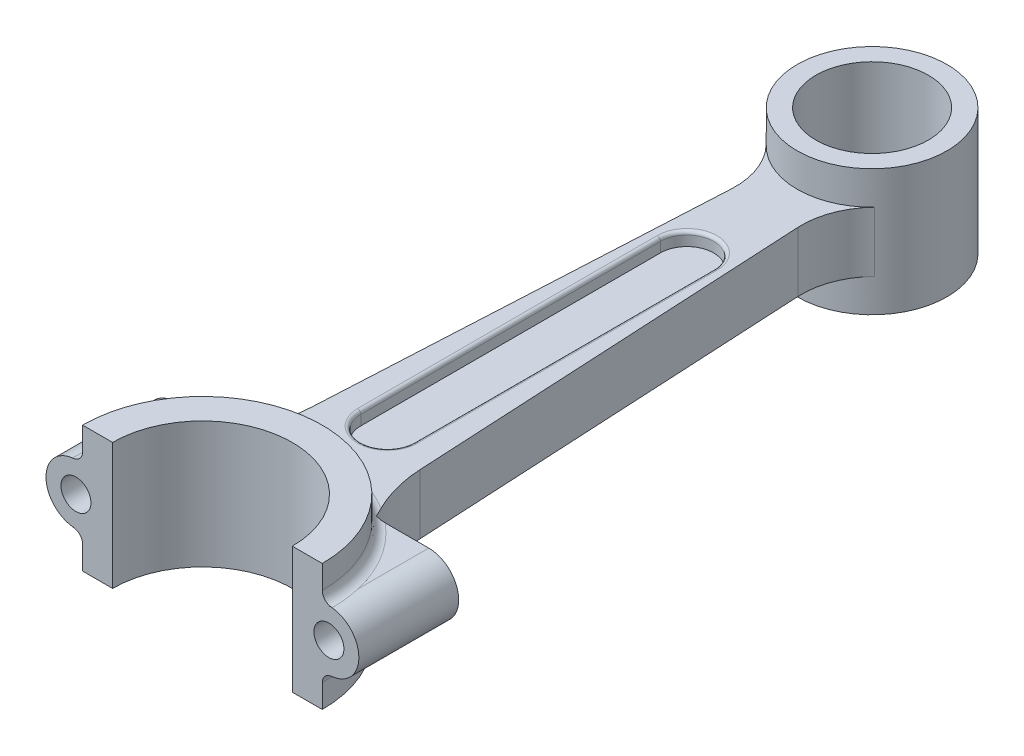
from build123d import *

# Parameters (mm, degrees)
SKETCH1_R             = 22.5
SKETCH1_R_2           = 16.9
BOSS_EXTRUDE1_DEPTH   = 19
BOSS_EXTRUDE1_2_DEPTH = 19
BOSS_EXTRUDE2_DEPTH   = 9
BOSS_EXTRUDE3_DEPTH   = 5
FILLET2_R             = 1
BOSS_EXTRUDE4_DEPTH   = 9
FILLET3_R             = 3
SKETCH5_R             = 4.5
CUT_EXTRUDE1_DEPTH    = 38


with BuildPart() as part:
    # Sketch1 → Boss-Extrude1 (new, symmetric)
    with BuildSketch(Plane(origin=(0, 0, 0), x_dir=(1, 0, 0), z_dir=(0, 1, 0))):
        with Locations(Location((0, 201.2, 0), (0, 0, 270))):
            Circle(SKETCH1_R)
        with Locations(Location((0, 201.2, 0), (0, 0, 270))):
            Circle(SKETCH1_R_2, mode=Mode.SUBTRACT)
    extrude(amount=BOSS_EXTRUDE1_DEPTH, both=True)



with BuildPart() as body_2:
    # Sketch1 → Boss-Extrude1 2 (new, symmetric)
    with BuildSketch(Plane(origin=(0, 0, 0), x_dir=(1, 0, 0), z_dir=(0, 1, 0))):
        with BuildLine():
            Line((27, 0), (36, 0))
            ThreePointArc((36, 0), (0, 36), (-36, 0))
            Line((-36, 0), (-27, 0))
            ThreePointArc((-27, 0), (0, 27), (27, 0))
        make_face()
    extrude(amount=BOSS_EXTRUDE1_2_DEPTH, both=True)


with BuildPart() as part_1:
    add(part.part)

    add(body_2.part)  # Boss-Extrude2 merges body 2
    # Sketch1<3> → Boss-Extrude2 (add, symmetric)
    with BuildSketch(Plane(origin=(0, 0, 0), x_dir=(1, 0, 0), z_dir=(0, 1, 0))):
        with BuildLine():
            ThreePointArc((-16.279722223, 49.041287854), (-19.307974883, 35.735363352), (-26.63284908, 24.221712365))
            ThreePointArc((-26.63284908, 24.221712365), (0, 36), (26.63284908, 24.221712365))
            ThreePointArc((26.63284908, 24.221712365), (19.307974883, 35.735363352), (16.279722223, 49.041287854))
            Line((16.279722223, 49.041287854), (10, 168.865525948))
            ThreePointArc((10, 168.865525948), (11.381584619, 177.889356271), (16.234582266, 185.621542482))
            ThreePointArc((16.234582266, 185.621542482), (0, 178.7), (-16.234582266, 185.621542482))
            ThreePointArc((-16.234582266, 185.621542482), (-11.381584619, 177.889356271), (-10, 168.865525948))
            Line((-10, 168.865525948), (-16.279722223, 49.041287854))
        make_face()
        with BuildLine():
            ThreePointArc((8, 55.6), (0, 47.6), (-8, 55.6))
            Line((-8, 55.6), (-8, 145.6))
            ThreePointArc((-8, 145.6), (0, 153.6), (8, 145.6))
            Line((8, 145.6), (8, 55.6))
        make_face(mode=Mode.SUBTRACT)
    extrude(amount=BOSS_EXTRUDE2_DEPTH, both=True)

    # Sketch1<4> → Boss-Extrude3 (add, symmetric)
    with BuildSketch(Plane(origin=(0, 0, 0), x_dir=(1, 0, 0), z_dir=(0, 1, 0))):
        with BuildLine():
            Line((8, 55.6), (8, 145.6))
            ThreePointArc((8, 145.6), (0, 153.6), (-8, 145.6))
            Line((-8, 145.6), (-8, 55.6))
            ThreePointArc((-8, 55.6), (0, 47.6), (8, 55.6))
        make_face()
    extrude(amount=BOSS_EXTRUDE3_DEPTH, both=True)

    # Fillet2
    fillet2_edges = [part_1.edges().sort_by_distance(p)[0] for p in [
        (0, 9, -153.6),
        (8, 9, -100.6),
        (0, 9, -47.6),
        (-8, -9, -100.6),
        (-8, 9, -100.6),
        (0, -9, -153.6),
        (0, -9, -47.6),
        (8, -9, -100.6),
    ]]
    fillet(fillet2_edges, radius=FILLET2_R)

    # Sketch3 → Boss-Extrude4 (add, symmetric)
    with BuildSketch(Plane(origin=(0, 0, 0), x_dir=(1, 0, 0), z_dir=(0, 1, 0))):
        with BuildLine():
            Line((-19.899748742, 30), (-49, 30))
            Line((-49, 30), (-49, 0))
            Line((-49, 0), (-36, 0))
            ThreePointArc((-36, 0), (-31.720584442, 17.023645986), (-19.899748742, 30))
        make_face()
        with BuildLine():
            Line((49, 30), (49, 0))
            Line((49, 0), (36, 0))
            ThreePointArc((36, 0), (31.720584442, 17.023645986), (19.899748742, 30))
            Line((19.899748742, 30), (49, 30))
        make_face()
    extrude(amount=BOSS_EXTRUDE4_DEPTH, both=True)

    # Fillet3
    # the kernel refuses this fillet: 3 mm, written as the material it adds along each edge
    with BuildSketch(Plane(origin=(0, 9, 0), x_dir=(-1, 0, 0), z_dir=(0, 0, 1))) as fillet3_piece_1_section:
        with BuildLine():
            CenterArc((36 + FILLET3_R, -FILLET3_R), FILLET3_R, 90, 90)
            Line((36, -FILLET3_R), (36, 0))
            Line((36, 0), (36 + FILLET3_R, 0))
        make_face()
    fillet3_piece_1 = revolve(axis=Axis((0, 9, 0), (0, -1, 0)), revolution_arc=180, mode=Mode.PRIVATE)
    fillet3_piece_1 = split(fillet3_piece_1, bisect_by=Plane(origin=(-34.322989988, 9.698532199, -30), z_dir=(0, 0, 1)), keep=Keep.TOP, mode=Mode.PRIVATE)
    add(fillet3_piece_1)
    with BuildSketch(Plane(origin=(0, 9, 0), x_dir=(-1, 0, 0), z_dir=(0, 0, 1))) as fillet3_piece_2_section:
        with BuildLine():
            CenterArc((36 + FILLET3_R, -FILLET3_R), FILLET3_R, 90, 90)
            Line((36, -FILLET3_R), (36, 0))
            Line((36, 0), (36 + FILLET3_R, 0))
        make_face()
    fillet3_piece_2 = revolve(axis=Axis((0, 9, 0), (0, -1, 0)), revolution_arc=180, mode=Mode.PRIVATE)
    fillet3_piece_2 = fillet3_piece_2 - Plane(origin=(56.224903613, 10.5000003, -51.134726104), x_dir=(-0.7398013633284897, 0, 0.6728253434713263), z_dir=(0, 1, 0)) * Cylinder(40, 157, mode=Mode.PRIVATE)
    fillet3_piece_2 = fillet3_piece_2 - Plane(origin=(-56.224903613, 10.5000003, -51.134726104), x_dir=(0.9986295347545738, 0, 0.05233595624294564), z_dir=(0, 1, 0)) * Cylinder(40, 157, mode=Mode.PRIVATE)
    add(fillet3_piece_2)
    with BuildSketch(Plane(origin=(0, -9, 0), x_dir=(1, 0, 0), z_dir=(0, 0, 1))) as fillet3_piece_3_section:
        with BuildLine():
            CenterArc((36 + FILLET3_R, -FILLET3_R), FILLET3_R, 90, 90)
            Line((36, -FILLET3_R), (36, 0))
            Line((36, 0), (36 + FILLET3_R, 0))
        make_face()
    fillet3_piece_3 = revolve(axis=Axis((0, -9, 0), (0, 1, 0)), revolution_arc=180, mode=Mode.PRIVATE)
    fillet3_piece_3 = split(fillet3_piece_3, bisect_by=Plane(origin=(34.322988047, -9.698532268, -30), z_dir=(0, 0, 1)), keep=Keep.TOP, mode=Mode.PRIVATE)
    add(fillet3_piece_3)
    with BuildSketch(Plane(origin=(0, -9, 0), x_dir=(1, 0, 0), z_dir=(0, 0, 1))) as fillet3_piece_4_section:
        with BuildLine():
            CenterArc((36 + FILLET3_R, -FILLET3_R), FILLET3_R, 90, 90)
            Line((36, -FILLET3_R), (36, 0))
            Line((36, 0), (36 + FILLET3_R, 0))
        make_face()
    fillet3_piece_4 = revolve(axis=Axis((0, -9, 0), (0, 1, 0)), revolution_arc=180, mode=Mode.PRIVATE)
    fillet3_piece_4 = fillet3_piece_4 - Plane(origin=(56.224903613, -10.5000003, -51.134726104), x_dir=(-0.7398013633284897, 0, 0.6728253434713263), z_dir=(0, 1, 0)) * Cylinder(40, 157, mode=Mode.PRIVATE)
    fillet3_piece_4 = fillet3_piece_4 - Plane(origin=(-56.224903613, -10.5000003, -51.134726104), x_dir=(0.9986295347545738, 0, 0.05233595624294564), z_dir=(0, 1, 0)) * Cylinder(40, 157, mode=Mode.PRIVATE)
    add(fillet3_piece_4)

    # Sketch5 → Cut-Extrude1 (cut)
    with BuildSketch(Plane.XY):
        with BuildLine():
            Line((39, -9), (49, -9))
            Line((49, -9), (49, 9))
            Line((49, 9), (39, 9))
            Line((39, 9), (38, 9))
            ThreePointArc((38, 9), (47, 0), (38, -9))
            Line((38, -9), (39, -9))
        make_face()
        with BuildLine():
            ThreePointArc((-38, 9), (-47, 0), (-38, -9))
            Line((-38, -9), (-49, -9))
            Line((-49, -9), (-49, 9))
            Line((-49, 9), (-38, 9))
        make_face()
        with Locations((38, 0)):
            Circle(SKETCH5_R)
        with Locations((-38, 0)):
            Circle(SKETCH5_R)
    extrude(amount=-CUT_EXTRUDE1_DEPTH, mode=Mode.SUBTRACT)


solid = part_1.part
